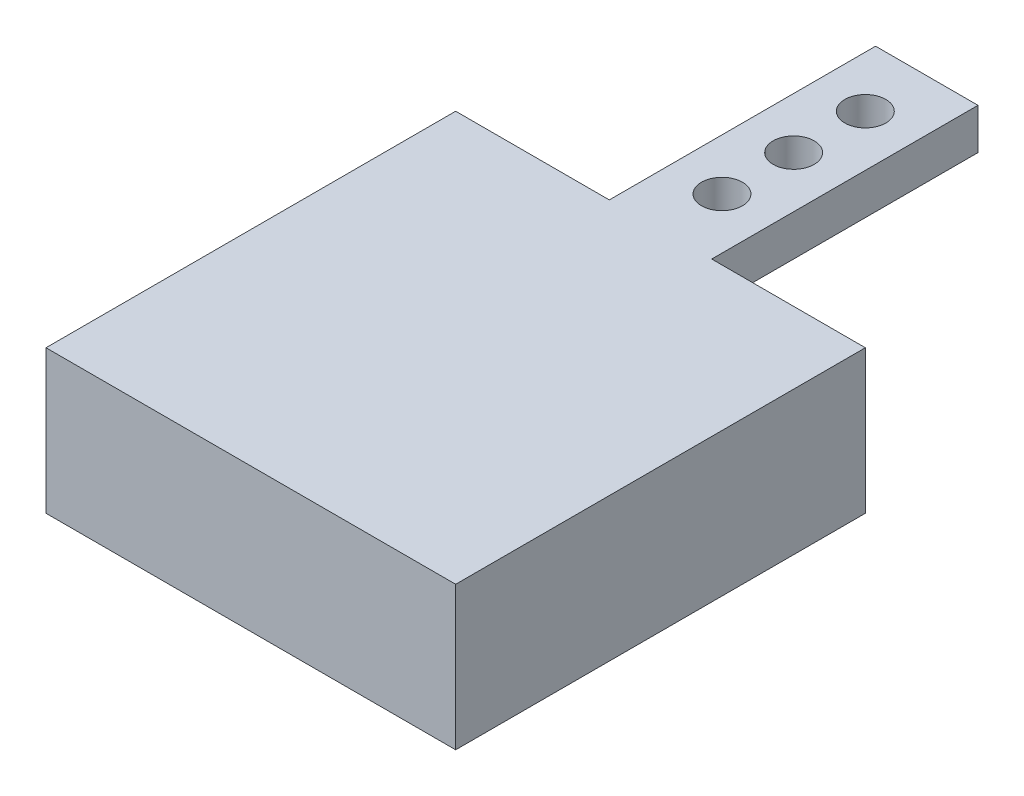
from build123d import *

# Parameters (mm, degrees)
SKETCH1_W           = 40
SKETCH1_H           = 40
BOSS_EXTRUDE1_DEPTH = 14
SKETCH4_W           = 10
SKETCH4_H           = 4
BOSS_EXTRUDE3_DEPTH = 26
SKETCH5_R           = 2
CUT_EXTRUDE2_DEPTH  = 26


with BuildPart() as part:
    # Sketch1 → Boss-Extrude1 (new body)
    with BuildSketch(Plane(origin=(0, 0, 0), x_dir=(1, 0, 0), z_dir=(0, 1, 0))):
        with Locations((20, 20)):
            Rectangle(SKETCH1_W, SKETCH1_H)
    extrude(amount=BOSS_EXTRUDE1_DEPTH)

    # Sketch4 → Boss-Extrude3 (add)
    with BuildSketch(Plane(origin=(0, 0, -40), x_dir=(-1, 0, 0), z_dir=(0, 0, -1))):
        with Locations((-20, 12)):
            Rectangle(SKETCH4_W, SKETCH4_H)
    extrude(amount=BOSS_EXTRUDE3_DEPTH)

    # Sketch5 → Cut-Extrude2 (cut)
    with BuildSketch(Plane(origin=(0, 14, 0), x_dir=(1, 0, 0), z_dir=(0, 1, 0))):
        with Locations((20, 60)):
            Circle(SKETCH5_R)
        with Locations((20, 53)):
            Circle(SKETCH5_R)
        with Locations((20, 46)):
            Circle(SKETCH5_R)
    extrude(amount=-CUT_EXTRUDE2_DEPTH, mode=Mode.SUBTRACT)


solid = part.part
